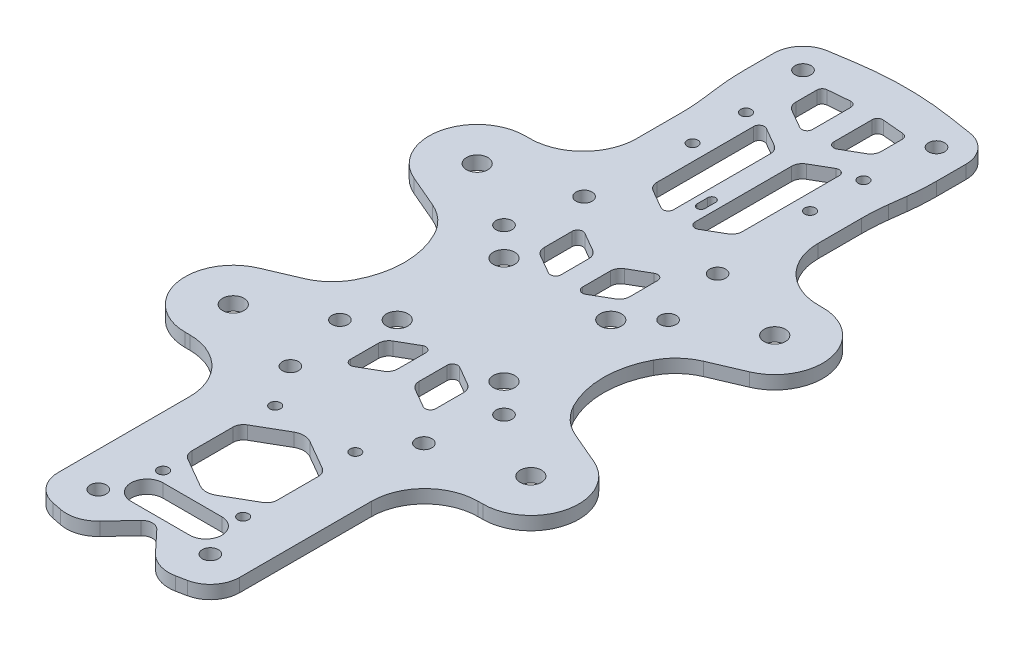
from build123d import *

# Parameters (mm, degrees)
SKETCH2_R           = 1
SKETCH2_R_2         = 1.5
SKETCH2_R_3         = 2
BOSS_EXTRUDE1_DEPTH = 2.5


with BuildPart() as part:
    # Sketch2 → Boss-Extrude1 (new body)
    with BuildSketch(Plane(origin=(0, 0, 0), x_dir=(1, 0, 0), z_dir=(0, 1, 0))):
        with BuildLine():
            Line((13.350883078, 73.933726478), (8.972891286, 74.619286567))
            ThreePointArc((8.972891286, 74.619286567), (-0.00011783, 75.317584084), (-8.973126945, 74.619286567))
            Line((-8.973126945, 74.619286567), (-13.350882829, 73.933763419))
            ThreePointArc((-13.350882829, 73.933763419), (-16.680339328, 72.07414751), (-17.999976849, 68.496158031))
            Line((-17.999976849, 68.496158031), (-17.99612821, 62.986537073))
            ThreePointArc((-17.99612821, 62.986537073), (-17.913159359, 60.376821385), (-17.66818978, 57.777304179))
            Line((-17.66818978, 57.777304179), (-17.287326461, 54.747455148))
            ThreePointArc((-17.287326461, 54.747455148), (-17.064020516, 52.368886066), (-16.990620696, 49.980985546))
            Line((-16.990620696, 49.980985546), (-16.994414065, 41.83534793))
            ThreePointArc((-16.994414065, 41.83534793), (-19.924991835, 34.767290769), (-26.994412981, 31.840004863))
            Line((-26.994412981, 31.840004863), (-27.864354565, 31.840004863))
            ThreePointArc((-27.864354565, 31.840004863), (-36.681216944, 24.646365231), (-31.403561403, 14.565102148))
            Line((-31.403561403, 14.565102148), (-25.40119143, 11.997866062))
            ThreePointArc((-25.40119143, 11.997866062), (-22.55844214, 10.158571988), (-20.492417257, 7.47607923))
            ThreePointArc((-20.492417257, 7.47607923), (-18.638379202, 0), (-20.492417257, -7.47607923))
            ThreePointArc((-20.492417257, -7.47607923), (-22.55844214, -10.158571988), (-25.40119143, -11.997866062))
            Line((-25.40119143, -11.997866062), (-31.403561403, -14.565102148))
            ThreePointArc((-31.403561403, -14.565102148), (-36.681216944, -24.646365231), (-27.864354565, -31.840004863))
            Line((-27.864354565, -31.840004863), (-26.999999944, -31.840004863))
            ThreePointArc((-26.999999944, -31.840004863), (-19.928932149, -34.768937035), (-16.999999944, -41.840004817))
            Line((-16.999999944, -41.840004817), (-16.999999829, -66.500000018))
            ThreePointArc((-16.999999829, -66.500000018), (-15.752129156, -69.988466165), (-12.574764869, -71.89396701))
            Line((-12.574764869, -71.89396701), (-10.754467086, -72.256667119))
            ThreePointArc((-10.754467086, -72.256667119), (-7.748879832, -72.085454613), (-5.204772908, -70.475986245))
            Line((-5.204772908, -70.475986245), (-1.459074237, -66.480574329))
            ThreePointArc((-1.459074237, -66.480574329), (1.71e-07, -65.848456587), (1.45907458, -66.480574329))
            Line((1.45907458, -66.480574329), (5.204773251, -70.475986245))
            ThreePointArc((5.204773251, -70.475986245), (7.748880174, -72.085454613), (10.754467429, -72.256667119))
            Line((10.754467429, -72.256667119), (12.574765212, -71.89396701))
            ThreePointArc((12.574765212, -71.89396701), (15.752129504, -69.988466158), (17.000000171, -66.5))
            Line((17.000000171, -66.5), (17.000000056, -41.84000491))
            ThreePointArc((17.000000056, -41.84000491), (19.928932228, -34.768937068), (27.000000056, -31.840004863))
            Line((27.000000056, -31.840004863), (27.864354565, -31.840004863))
            ThreePointArc((27.864354565, -31.840004863), (36.681216944, -24.646365231), (31.403561403, -14.565102148))
            Line((31.403561403, -14.565102148), (25.40119143, -11.997866062))
            ThreePointArc((25.40119143, -11.997866062), (22.55844214, -10.158571988), (20.492417257, -7.47607923))
            ThreePointArc((20.492417257, -7.47607923), (18.638379202, 0), (20.492417257, 7.47607923))
            ThreePointArc((20.492417257, 7.47607923), (22.55844214, 10.158571988), (25.40119143, 11.997866062))
            Line((25.40119143, 11.997866062), (31.403561403, 14.565102148))
            ThreePointArc((31.403561403, 14.565102148), (36.681216944, 24.646365231), (27.864354565, 31.840004863))
            Line((27.864354565, 31.840004863), (26.994413119, 31.840004863))
            ThreePointArc((26.994413119, 31.840004863), (19.924991932, 34.767290809), (16.994414203, 41.835348045))
            Line((16.994414203, 41.835348045), (16.990620673, 49.981415095))
            ThreePointArc((16.990620673, 49.981415095), (17.064035313, 52.369081916), (17.28732671, 54.747418207))
            Line((17.28732671, 54.747418207), (17.668190029, 57.777267238))
            ThreePointArc((17.668190029, 57.777267238), (17.913159608, 60.376784444), (17.996128459, 62.986500132))
            Line((17.996128459, 62.986500132), (17.999945801, 68.496188877))
            ThreePointArc((17.999945801, 68.496188877), (16.680306987, 72.074134906), (13.350883078, 73.933726478))
        make_face()
        with Locations((-7.5, -35.348457)):
            Circle(SKETCH2_R, mode=Mode.SUBTRACT)
        with Locations((-7.5, -56.348457)):
            Circle(SKETCH2_R, mode=Mode.SUBTRACT)
        with Locations((7.5, -35.348457)):
            Circle(SKETCH2_R, mode=Mode.SUBTRACT)
        with Locations((7.5, -56.348457)):
            Circle(SKETCH2_R, mode=Mode.SUBTRACT)
        with Locations((-11.000072461, 46.317584084)):
            Circle(SKETCH2_R, mode=Mode.SUBTRACT)
        with Locations((10.999927539, 46.317584084)):
            Circle(SKETCH2_R, mode=Mode.SUBTRACT)
        with Locations((10.999927539, 56.317584084)):
            Circle(SKETCH2_R, mode=Mode.SUBTRACT)
        with Locations((-11.000072461, 56.317584084)):
            Circle(SKETCH2_R, mode=Mode.SUBTRACT)
        with Locations((10.500000167, -65.500000004)):
            Circle(SKETCH2_R_2, mode=Mode.SUBTRACT)
        with Locations((-10.499999829, -65.5)):
            Circle(SKETCH2_R_2, mode=Mode.SUBTRACT)
        with Locations((10.000016395, -10.000011804)):
            Circle(SKETCH2_R_3, mode=Mode.SUBTRACT)
        with Locations((15.365, -15.365)):
            Circle(SKETCH2_R_2, mode=Mode.SUBTRACT)
        with Locations((27.864354565, -22.840004863)):
            Circle(SKETCH2_R_3, mode=Mode.SUBTRACT)
        with Locations((12.500000171, -27.5)):
            Circle(SKETCH2_R_2, mode=Mode.SUBTRACT)
        with Locations((-10.000016395, -10.000011804)):
            Circle(SKETCH2_R_3, mode=Mode.SUBTRACT)
        with Locations((-15.365, -15.365)):
            Circle(SKETCH2_R_2, mode=Mode.SUBTRACT)
        with Locations((-12.499999829, -27.5)):
            Circle(SKETCH2_R_2, mode=Mode.SUBTRACT)
        with Locations((-27.864354565, -22.840004863)):
            Circle(SKETCH2_R_3, mode=Mode.SUBTRACT)
        with Locations((27.864354565, 22.840004863)):
            Circle(SKETCH2_R_3, mode=Mode.SUBTRACT)
        with Locations((15.365, 15.365)):
            Circle(SKETCH2_R_2, mode=Mode.SUBTRACT)
        with Locations((10.000016395, 10.000011804)):
            Circle(SKETCH2_R_3, mode=Mode.SUBTRACT)
        with Locations((-10.000016395, 10.000011804)):
            Circle(SKETCH2_R_3, mode=Mode.SUBTRACT)
        with Locations((-15.365, 15.365)):
            Circle(SKETCH2_R_2, mode=Mode.SUBTRACT)
        with Locations((-27.864354565, 22.840004863)):
            Circle(SKETCH2_R_3, mode=Mode.SUBTRACT)
        with Locations((-12.5, 27.5)):
            Circle(SKETCH2_R_2, mode=Mode.SUBTRACT)
        with Locations((12.5, 27.5)):
            Circle(SKETCH2_R_2, mode=Mode.SUBTRACT)
        with Locations((-12.499997086, 68.499999935)):
            Circle(SKETCH2_R_2, mode=Mode.SUBTRACT)
        with Locations((12.500002914, 68.499999467)):
            Circle(SKETCH2_R_2, mode=Mode.SUBTRACT)
        with BuildLine():
            Line((0.749999899, 38.901923806), (0.749999899, 36.901923806))
            ThreePointArc((0.749999899, 36.901923806), (-1.01e-07, 36.151923806), (-0.750000101, 36.901923806))
            Line((-0.750000101, 36.901923806), (-0.750000101, 38.901923806))
            ThreePointArc((-0.750000101, 38.901923806), (-1.01e-07, 39.651923806), (0.749999899, 38.901923806))
        make_face(mode=Mode.SUBTRACT)
        with BuildLine():
            Line((-5.5, -58.348456587), (5.5, -58.348456587))
            ThreePointArc((5.5, -58.348456587), (8.5, -61.348456587), (5.5, -64.348456587))
            Line((5.5, -64.348456587), (-5.5, -64.348456587))
            ThreePointArc((-5.5, -64.348456587), (-8.5, -61.348456587), (-5.5, -58.348456587))
        make_face(mode=Mode.SUBTRACT)
        with BuildLine():
            Line((7, -41.041451884), (1.5, -37.866025404))
            ThreePointArc((1.5, -37.866025404), (0, -37.464101615), (-1.5, -37.866025404))
            Line((-1.5, -37.866025404), (-7, -41.041451884))
            ThreePointArc((-7, -41.041451884), (-7.732050808, -41.773502692), (-8, -42.773502692))
            Line((-8, -42.773502692), (-8, -50.464101615))
            ThreePointArc((-8, -50.464101615), (-7.732050808, -51.464101615), (-7, -52.196152423))
            Line((-7, -52.196152423), (-1.5, -55.371578903))
            ThreePointArc((-1.5, -55.371578903), (0, -55.773502692), (1.5, -55.371578903))
            Line((1.5, -55.371578903), (7, -52.196152423))
            ThreePointArc((7, -52.196152423), (7.732050808, -51.464101615), (8, -50.464101615))
            Line((8, -50.464101615), (8, -42.773502692))
            ThreePointArc((8, -42.773502692), (7.732050808, -41.773502692), (7, -41.041451884))
        make_face(mode=Mode.SUBTRACT)
        with BuildLine():
            Line((2.999999875, -19.613248636), (6.499999844, -21.633974619))
            ThreePointArc((6.499999844, -21.633974619), (7.500547408, -21.634424586), (8.001989831, -20.768600628))
            Line((8.001989831, -20.768600628), (8.011329949, -15.576420031))
            ThreePointArc((8.011329949, -15.576420031), (7.74515233, -14.5758914), (7.014351026, -13.842517334))
            Line((7.014351026, -13.842517334), (3.517878924, -11.815693189))
            ThreePointArc((3.517878924, -11.815693189), (2.517469418, -11.814186451), (2.016370335, -12.680050851))
            Line((2.016370335, -12.680050851), (2.012220809, -17.900793835))
            ThreePointArc((2.012220809, -17.900793835), (2.276502543, -18.889463725), (2.999999875, -19.613248636))
        make_face(mode=Mode.SUBTRACT)
        with BuildLine():
            Line((-6.500000155, -21.633974611), (-3.00000291, -19.61325026))
            ThreePointArc((-3.00000291, -19.61325026), (-2.26349058, -18.877378982), (-1.992712343, -17.872075))
            Line((-1.992712343, -17.872075), (-1.983656412, -12.672108118))
            ThreePointArc((-1.983656412, -12.672108118), (-2.482135392, -11.805233368), (-3.482110435, -11.803490607))
            Line((-3.482110435, -11.803490607), (-6.985627702, -13.818112198))
            ThreePointArc((-6.985627702, -13.818112198), (-7.718918203, -14.548849716), (-7.988598804, -15.548331908))
            Line((-7.988598804, -15.548331908), (-7.997709151, -20.767528161))
            ThreePointArc((-7.997709151, -20.767528161), (-7.499228332, -21.633538561), (-6.500000155, -21.633974611))
        make_face(mode=Mode.SUBTRACT)
        with BuildLine():
            Line((3.517878923, 11.815693192), (7.014351026, 13.842517334))
            ThreePointArc((7.014351026, 13.842517334), (7.74515233, 14.5758914), (8.011329949, 15.576420031))
            Line((8.011329949, 15.576420031), (8.001989831, 20.768600628))
            ThreePointArc((8.001989831, 20.768600628), (7.500547408, 21.634424586), (6.499999844, 21.633974619))
            Line((6.499999844, 21.633974619), (2.999999852, 19.613248675))
            ThreePointArc((2.999999852, 19.613248675), (2.276502504, 18.889463747), (2.012220763, 17.900793835))
            Line((2.012220763, 17.900793835), (2.016370338, 12.680050851))
            ThreePointArc((2.016370338, 12.680050851), (2.517469419, 11.814186454), (3.517878923, 11.815693192))
        make_face(mode=Mode.SUBTRACT)
        with BuildLine():
            Line((-3.00000291, 19.61325026), (-6.500000155, 21.633974611))
            ThreePointArc((-6.500000155, 21.633974611), (-7.499228332, 21.633538561), (-7.997709151, 20.767528161))
            Line((-7.997709151, 20.767528161), (-7.988598804, 15.548331908))
            ThreePointArc((-7.988598804, 15.548331908), (-7.718918202, 14.548849716), (-6.985627702, 13.818112198))
            Line((-6.985627702, 13.818112198), (-3.482110435, 11.803490607))
            ThreePointArc((-3.482110435, 11.803490607), (-2.482135392, 11.805233368), (-1.983656412, 12.672108118))
            Line((-1.983656412, 12.672108118), (-1.992712343, 17.872075))
            ThreePointArc((-1.992712343, 17.872075), (-2.26349058, 18.877378982), (-3.00000291, 19.61325026))
        make_face(mode=Mode.SUBTRACT)
        with BuildLine():
            Line((3.499999899, 32.901923807), (6.999999893, 34.922649745))
            ThreePointArc((6.999999893, 34.922649745), (7.732050697, 35.654700549), (7.999999886, 36.654700545))
            Line((7.999999886, 36.654700545), (7.999999845, 54.767949218))
            ThreePointArc((7.999999845, 54.767949218), (7.499999844, 55.63397462), (6.499999845, 55.633974619))
            Line((6.499999845, 55.633974619), (2.999999852, 53.61324868))
            ThreePointArc((2.999999852, 53.61324868), (2.267949047, 52.881197873), (1.999999857, 51.881197876))
            Line((1.999999857, 51.881197876), (1.999999896, 33.767949211))
            ThreePointArc((1.999999896, 33.767949211), (2.499999898, 32.901923807), (3.499999899, 32.901923807))
        make_face(mode=Mode.SUBTRACT)
        with BuildLine():
            Line((-7.000000107, 34.922649752), (-3.500000101, 32.901923805))
            ThreePointArc((-3.500000101, 32.901923805), (-2.500023539, 32.901923382), (-2.00003416, 33.767927854))
            Line((-2.00003416, 33.767927854), (-2.000000143, 51.881191279))
            ThreePointArc((-2.000000143, 51.881191279), (-2.267949232, 52.881195963), (-3.00000291, 53.61325026))
            Line((-3.00000291, 53.61325026), (-6.500000155, 55.63397461))
            ThreePointArc((-6.500000155, 55.63397461), (-7.500001159, 55.633974031), (-8.000000155, 54.767946888))
            Line((-8.000000155, 54.767946888), (-7.999953523, 36.654615238))
            ThreePointArc((-7.999953523, 36.654615238), (-7.732015654, 35.654664451), (-7.000000107, 34.922649752))
        make_face(mode=Mode.SUBTRACT)
        with BuildLine():
            Line((3.499999898, 58.901923808), (6.999999892, 60.922649745))
            ThreePointArc((6.999999892, 60.922649745), (7.732050701, 61.654700553), (7.999999893, 62.654700553))
            Line((7.999999893, 62.654700553), (7.999999882, 66.594635247))
            ThreePointArc((7.999999882, 66.594635247), (7.737277218, 67.270225453), (7.087155625, 67.590829944))
            Line((7.087155625, 67.590829944), (3.087155624, 67.940784602))
            ThreePointArc((3.087155624, 67.940784602), (2.324409672, 67.68186724), (1.99999988, 66.944589901))
            Line((1.99999988, 66.944589901), (1.999999898, 59.76794921))
            ThreePointArc((1.999999898, 59.76794921), (2.499999899, 58.901923808), (3.499999898, 58.901923808))
        make_face(mode=Mode.SUBTRACT)
        with BuildLine():
            Line((-7.000000108, 60.922649753), (-3.500000102, 58.901923807))
            ThreePointArc((-3.500000102, 58.901923807), (-2.500000101, 58.901923807), (-2.000000102, 59.767949212))
            Line((-2.000000102, 59.767949212), (-2.000000119, 66.9445899))
            ThreePointArc((-2.000000119, 66.9445899), (-2.324409912, 67.681867235), (-3.087155862, 67.940784596))
            Line((-3.087155862, 67.940784596), (-7.087155862, 67.590829942))
            ThreePointArc((-7.087155862, 67.590829942), (-7.737277457, 67.27022545), (-8.00000012, 66.594635241))
            Line((-8.00000012, 66.594635241), (-8.000000107, 62.654700557))
            ThreePointArc((-8.000000107, 62.654700557), (-7.732050914, 61.654700559), (-7.000000108, 60.922649753))
        make_face(mode=Mode.SUBTRACT)
    extrude(amount=BOSS_EXTRUDE1_DEPTH)


solid = part.part
